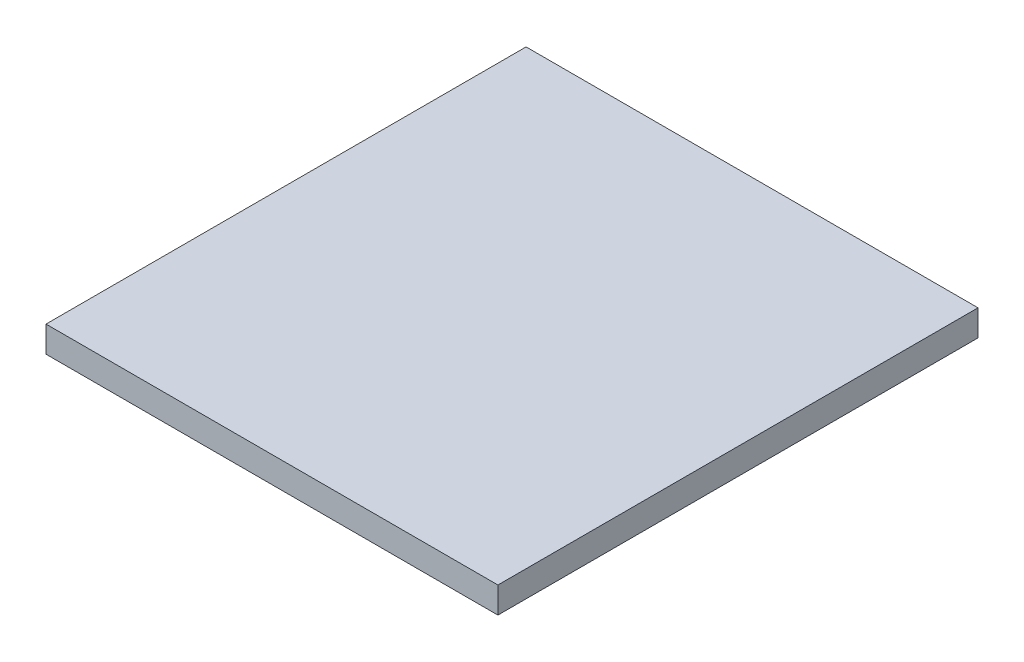
from build123d import *

# Parameters (mm, degrees)
SKETCH1_W           = 109.982
SKETCH1_H           = 116.84
BOSS_EXTRUDE1_DEPTH = 3.175


with BuildPart() as part:
    # Sketch1 → Boss-Extrude1 (new, symmetric)
    with BuildSketch(Plane(origin=(0, 0, 0), x_dir=(1, 0, 0), z_dir=(0, 1, 0))):
        Rectangle(SKETCH1_W, SKETCH1_H)
    extrude(amount=BOSS_EXTRUDE1_DEPTH, both=True)


solid = part.part
